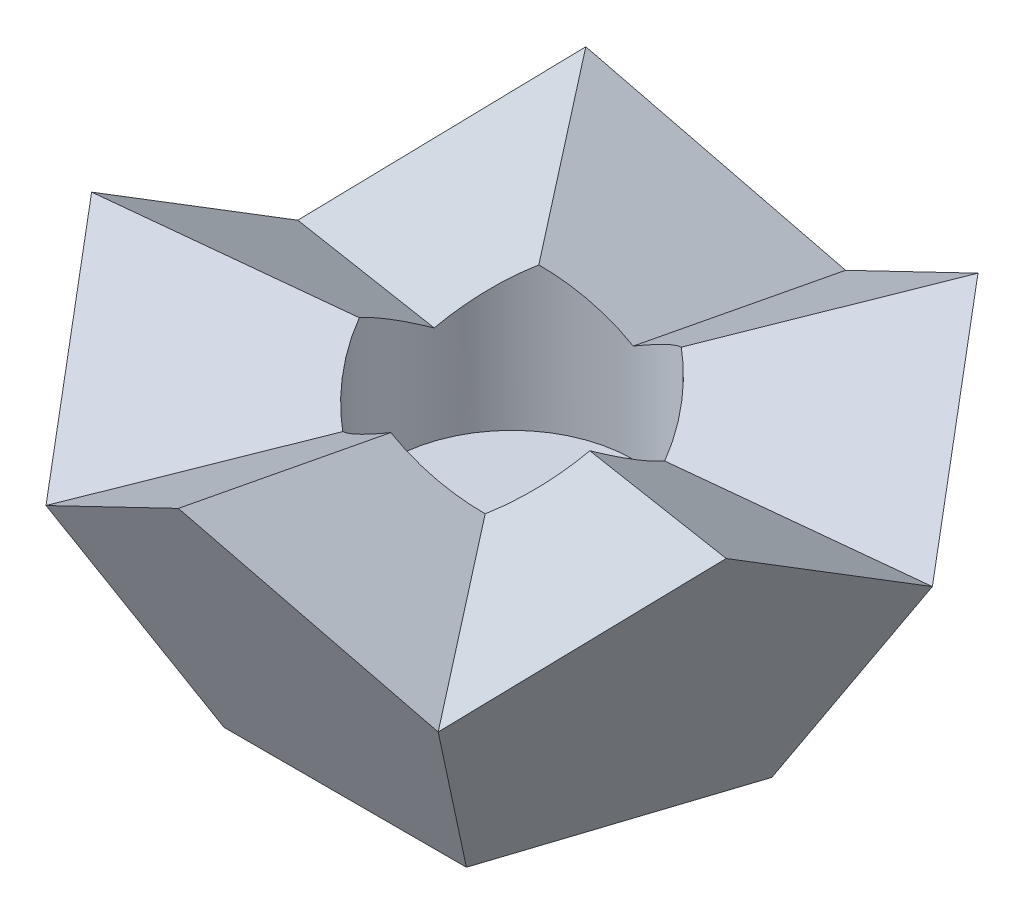
from build123d import *

# Parameters (mm, degrees)
BOSS_EXTRUDE1_DEPTH     = 6.35
BOSS_EXTRUDE1_TAPER     = 31.717474411
CUT_EXTRUDE1_DEPTH      = 3.175
CUT_EXTRUDE1_DEPTH_BACK = 15.650493647
SKETCH4_R               = 3.175


with BuildPart() as part:
    # Sketch2 → Boss-Extrude1 (new body)
    with BuildSketch(Plane(origin=(0, 0, 0), x_dir=(1, 0, 0), z_dir=(0, 1, 0))):
        Polygon((0, 5.401632633), (-5.137257914, 1.669196281), (-3.175, -4.370012597), (3.175, -4.370012597), (5.137257914, 1.669196281), align=None)
    boss_extrude1 = extrude(amount=BOSS_EXTRUDE1_DEPTH, taper=BOSS_EXTRUDE1_TAPER)

    # Mirror1: Boss-Extrude1 across plane
    add(boss_extrude1.mirror(Plane(origin=(5.137257914, 0, -1.669196281), x_dir=(0.4742680099309791, 0.49867489660708536, 0.7255296012224598), z_dir=(0.49999999999999956, 0.5257311121191346, -0.6881909602355865))))

    # Mirror3: Boss-Extrude1 across plane
    add(boss_extrude1.mirror(Plane(origin=(-5.137257914, 0, -1.669196281), x_dir=(0.22041412184245487, -0.14323377902898687, 0.9648324722134382), z_dir=(-0.8090169943749469, 0.5257311121191347, 0.26286555605956663))))

    # Mirror4: Boss-Extrude1 across plane
    add(boss_extrude1.mirror(Plane(origin=(0, 0, -5.401632633), x_dir=(-0.47426800993097906, 0.49867489660708497, 0.72552960122246), z_dir=(-0.4999999999999999, 0.5257311121191347, -0.6881909602355861))))

    # Mirror5: Boss-Extrude1 across plane
    add(boss_extrude1.mirror(Plane(origin=(-3.175, 0, 4.370012597), x_dir=(0, -0.8506508083520393, 0.5257311121191346), z_dir=(0, 0.5257311121191346, 0.8506508083520393))))

    # Mirror6: Boss-Extrude1 across plane
    add(boss_extrude1.mirror(Plane(origin=(3.175, 0, 4.370012597), x_dir=(-0.2204141218424549, -0.14323377902898687, 0.9648324722134382), z_dir=(0.8090169943749468, 0.5257311121191346, 0.2628655560595667))))

    # Sketch4 → Cut-Extrude1 (cut, two sides: drawn at the far end of the back side and taken through both)
    with BuildSketch(Plane(origin=(0.261856431, 7.070828914, -0.805911226), x_dir=(-1, 0, 0), z_dir=(0, -1, 0)).offset(-CUT_EXTRUDE1_DEPTH_BACK)):
        with Locations((0.261856431, -0.805911226)):
            Circle(SKETCH4_R)
    extrude(amount=CUT_EXTRUDE1_DEPTH + CUT_EXTRUDE1_DEPTH_BACK, mode=Mode.SUBTRACT)


solid = part.part
